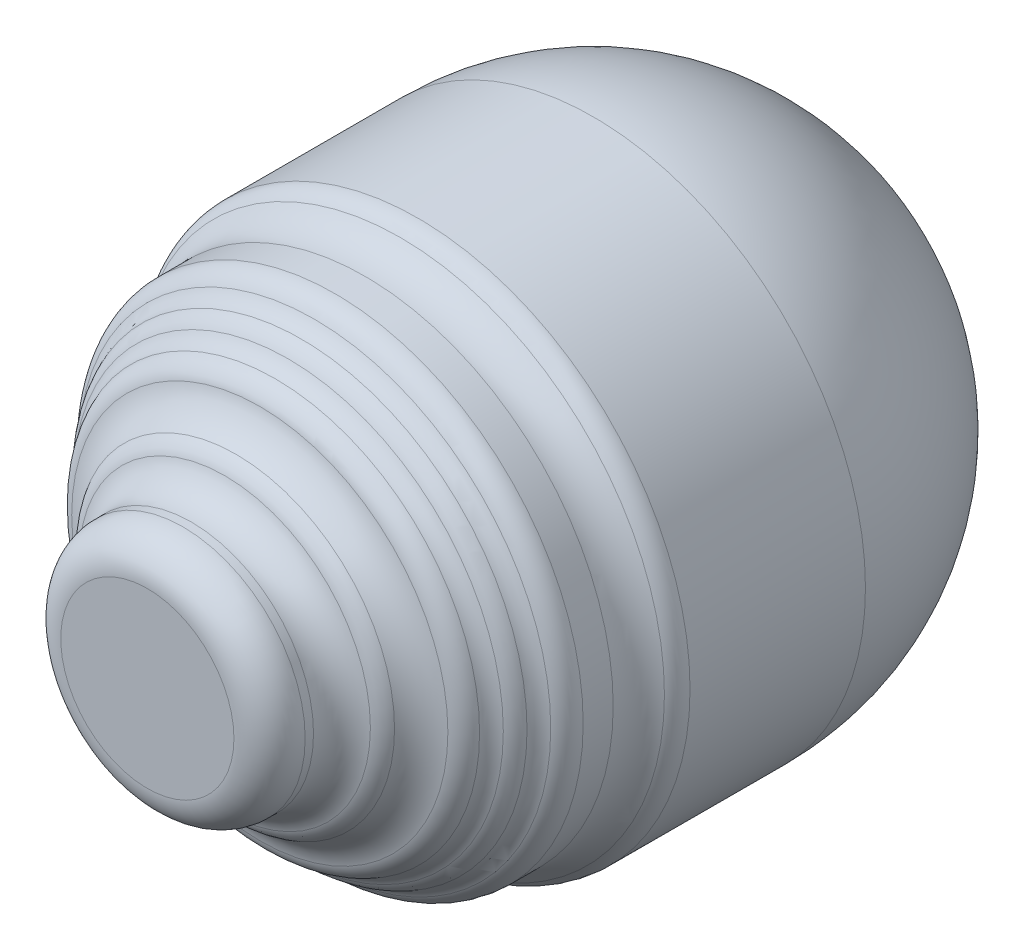
from build123d import *

# Parameters (mm, degrees)
SKETCH5_R            = 29.089891807
BOSS_EXTRUDE1_DEPTH  = 21.300978991
FILLET1_R            = 2.54
SKETCH6_R            = 26.549891807
BOSS_EXTRUDE5_DEPTH  = 8.89
FILLET7_R            = 2.54
SKETCH9_R            = 24.009891807
BOSS_EXTRUDE6_DEPTH  = 2.794
FILLET8_R            = 2.54
FILLET9_R            = 2.54
SKETCH11_R           = 21.730238108
BOSS_EXTRUDE7_DEPTH  = 2.794
FILLET10_R           = 2.54
FILLET11_R           = 2.54
SKETCH12_R           = 16.470643336
BOSS_EXTRUDE8_DEPTH  = 3.81
FILLET12_R           = 5.08
FILLET13_R           = 2.54
SKETCH13_R           = 13.072210804
BOSS_EXTRUDE9_DEPTH  = 8.128
FILLET14_R           = 3.81
FILLET15_R           = 3.81
FILLET17_R           = 5.08
SKETCH15_R           = 5.311713254
CUT_EXTRUDE1_DEPTH   = 84.328
SKETCH16_R           = 5.311713254
BOSS_EXTRUDE10_DEPTH = 10.16


with BuildPart() as part:
    # Revolve1: read off the stored shape, not the designer's step
    # Revolve1 outline → Revolve1 (revolve)
    with BuildSketch(Plane(origin=(-276.657629022, 0, 0), x_dir=(1, 0, 0), z_dir=(0, -1, 0))):
        with BuildLine():
            Line((0, 2.9e-08), (0, -29.089891807))
            ThreePointArc((0, -29.089891807), (20.569659771, -20.569659751), (29.089891807, 2.9e-08))
            Line((29.089891807, 2.9e-08), (0, 2.9e-08))
        make_face()
    revolve(axis=Axis((-276.657629022, 0, 0), (0, 0, 1)))

    # Sketch5 → Boss-Extrude1 (add)
    with BuildSketch(Plane.XY):
        with Locations(Location((-276.657629022, 0, 0), (0, 0, 270))):
            Circle(SKETCH5_R)
    extrude(amount=BOSS_EXTRUDE1_DEPTH)

    # Fillet1
    fillet1_edges = [part.edges().sort_by_distance(p)[0] for p in [
        (-276.657629022, 29.089891807, 21.300978991),
    ]]
    fillet(fillet1_edges, radius=FILLET1_R)

    # Sketch6 → Boss-Extrude5 (add)
    with BuildSketch(Plane.XY.offset(21.300978991)):
        with Locations((-276.657629022, 0)):
            Circle(SKETCH6_R)
    extrude(amount=BOSS_EXTRUDE5_DEPTH)

    # Fillet7
    fillet7_edges = [part.edges().sort_by_distance(p)[0] for p in [
        (-303.207520829, 0, 30.190978991),
    ]]
    fillet(fillet7_edges, radius=FILLET7_R)

    # Sketch9 → Boss-Extrude6 (add)
    with BuildSketch(Plane.XY.offset(30.190978991)):
        with Locations((-276.657629022, 0)):
            Circle(SKETCH9_R)
    extrude(amount=BOSS_EXTRUDE6_DEPTH)

    # Fillet8
    fillet8_edges = [part.edges().sort_by_distance(p)[0] for p in [
        (-300.667520829, 0, 30.190978991),
    ]]
    fillet(fillet8_edges, radius=FILLET8_R)

    # Fillet9
    fillet9_edges = [part.edges().sort_by_distance(p)[0] for p in [
        (-300.667520829, 0, 32.984978991),
    ]]
    fillet(fillet9_edges, radius=FILLET9_R)

    # Sketch11 → Boss-Extrude7 (add)
    with BuildSketch(Plane.XY.offset(32.984978991)):
        with Locations((-276.657629022, 0)):
            Circle(SKETCH11_R)
    extrude(amount=BOSS_EXTRUDE7_DEPTH)

    # Fillet10
    fillet10_edges = [part.edges().sort_by_distance(p)[0] for p in [
        (-298.38786713, 0, 32.984978991),
    ]]
    fillet(fillet10_edges, radius=FILLET10_R)

    # Fillet11
    fillet11_edges = [part.edges().sort_by_distance(p)[0] for p in [
        (-298.38786713, 0, 35.778978991),
    ]]
    fillet(fillet11_edges, radius=FILLET11_R)

    # Sketch12 → Boss-Extrude8 (add)
    with BuildSketch(Plane.XY.offset(35.778978991)):
        with Locations((-276.657629022, 0)):
            Circle(SKETCH12_R)
    extrude(amount=BOSS_EXTRUDE8_DEPTH)

    # Fillet12
    # the kernel refuses this fillet: 5.08 mm, written as the material it adds along each edge
    with BuildSketch(Plane(origin=(-276.657629022, 0, 35.778978991), x_dir=(1, 0, 0), z_dir=(0, -1, 0))) as fillet12_piece_1:
        with BuildLine():
            CenterArc((21.4506778, 4.812824385), FILLET12_R, 191.385331721, 63.397433483)
            Line((16.470643336, 3.81), (15.97263989, 3.709717562))
            ThreePointArc((15.97263989, 3.709717562), (15.962643336, 1.905), (15.962643336, 0))
            Line((15.962643336, 0), (16.470643336, -0.508))
            ThreePointArc((16.470643336, -0.508), (19.450584409, -0.508), (19.983942647, -0.579246831))
            Line((19.983942647, -0.579246831), (20.117282206, -0.089058538))
        make_face()
    revolve(axis=Axis((-276.657629022, 0, 35.778978991), (0, 0, 1)))

    # Fillet13
    fillet13_edges = [part.edges().sort_by_distance(p)[0] for p in [
        (-293.128272358, 0, 39.588978991),
    ]]
    fillet(fillet13_edges, radius=FILLET13_R)

    # Sketch13 → Boss-Extrude9 (add)
    with BuildSketch(Plane.XY.offset(39.588978991)):
        with Locations((-276.657629022, 0)):
            Circle(SKETCH13_R)
    extrude(amount=BOSS_EXTRUDE9_DEPTH)

    # Fillet14
    fillet14_edges = [part.edges().sort_by_distance(p)[0] for p in [
        (-289.729839826, 0, 47.716978991),
    ]]
    fillet(fillet14_edges, radius=FILLET14_R)

    # Fillet15
    fillet15_edges = [part.edges().sort_by_distance(p)[0] for p in [
        (-289.729839826, 0, 39.588978991),
    ]]
    fillet(fillet15_edges, radius=FILLET15_R)

    # Fillet17
    fillet17_edges = [part.edges().sort_by_distance(p)[0] for p in [
        (-257.884020485, -18.773608537, 21.300978991),
    ]]
    fillet(fillet17_edges, radius=FILLET17_R)

    # Sketch15 → Cut-Extrude1 (cut)
    with BuildSketch(Plane.XY.offset(47.716978991)):
        with Locations((-276.657629022, 0)):
            Circle(SKETCH15_R)
    extrude(amount=-CUT_EXTRUDE1_DEPTH, mode=Mode.SUBTRACT)

    # Sketch16 → Boss-Extrude10 (add)
    with BuildSketch(Plane.XY.offset(47.716978991)):
        with Locations((-276.657629022, 0)):
            Circle(SKETCH16_R)
    extrude(amount=-BOSS_EXTRUDE10_DEPTH)


solid = part.part
